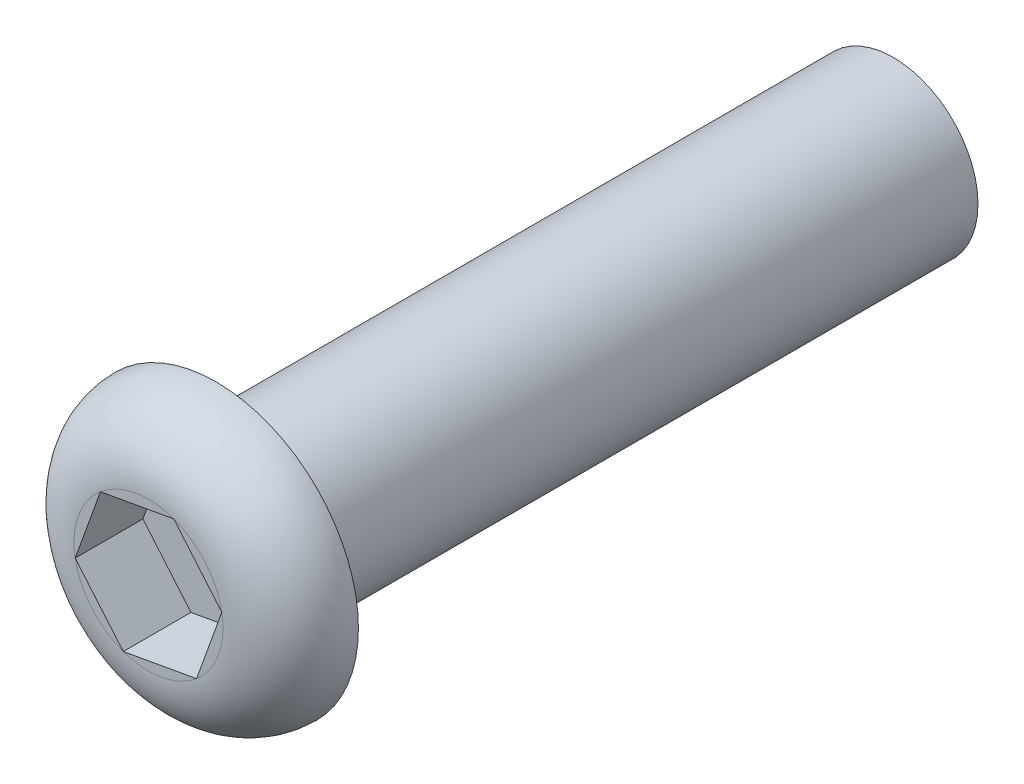
from build123d import *

# Parameters (mm, degrees)
SKETCH1_R           = 3.175
BOSS_EXTRUDE1_DEPTH = 25.4
SKETCH2_R           = 5.334
BOSS_EXTRUDE2_DEPTH = 2.54
FILLET3_R           = 2.54
CUT_EXTRUDE2_DEPTH  = 2.54


with BuildPart() as part:
    # Sketch1 → Boss-Extrude1 (new body)
    with BuildSketch(Plane.XY):
        Circle(SKETCH1_R)
    extrude(amount=BOSS_EXTRUDE1_DEPTH)

    # Sketch2 → Boss-Extrude2 (add)
    with BuildSketch(Plane.XY.offset(25.4)):
        Circle(SKETCH2_R)
    extrude(amount=BOSS_EXTRUDE2_DEPTH)

    # Fillet3
    fillet3_edges = [part.edges().sort_by_distance(p)[0] for p in [
        (-5.334, 0, 27.94),
    ]]
    fillet(fillet3_edges, radius=FILLET3_R - 0.0001)  # a hair under: the kernel refuses the full size

    # Sketch6 → Cut-Extrude2 (cut)
    with BuildSketch(Plane.XY.offset(27.94)):
        Polygon((1.802599016, -2.134730144), (2.750030043, 0.493731468), (0.947431027, 2.628461612), (-1.802599016, 2.134730144), (-2.750030043, -0.493731468), (-0.947431027, -2.628461612), align=None)
    extrude(amount=-CUT_EXTRUDE2_DEPTH, mode=Mode.SUBTRACT)


solid = part.part
